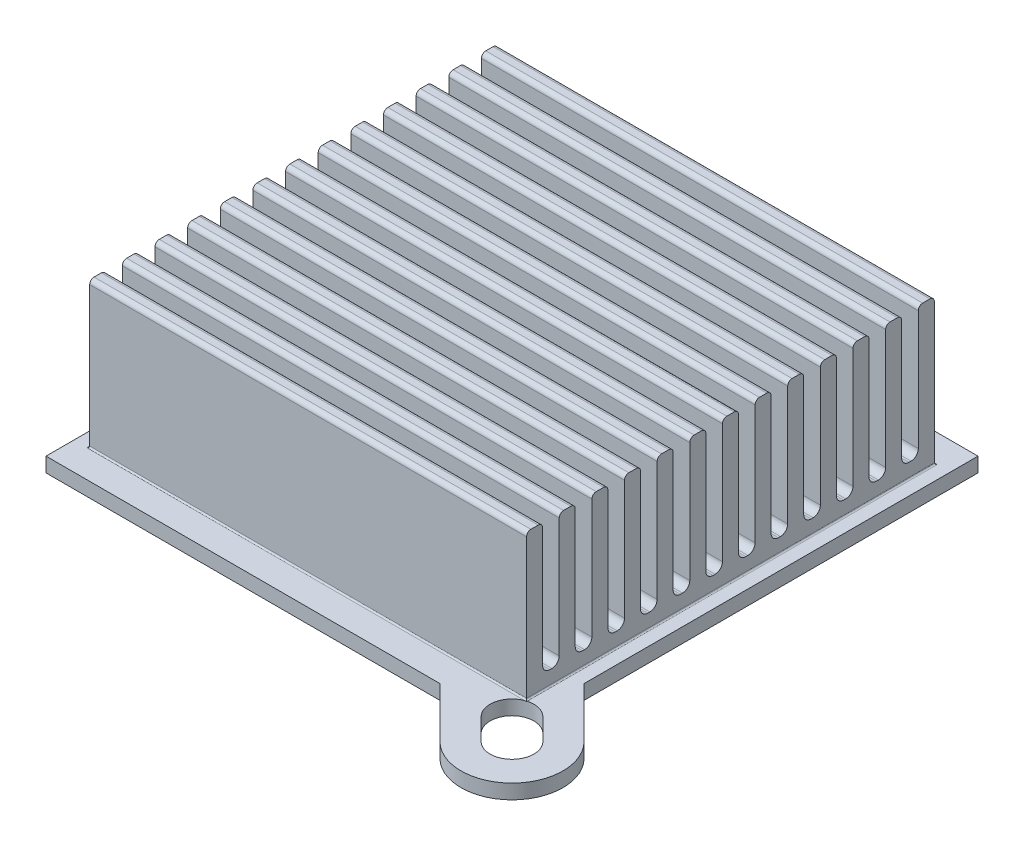
from build123d import *

# Parameters (mm, degrees)
SZKIC1_W                    = 32
SZKIC1_H                    = 32
DODANIE_WYCI_GNI_CIE2_DEPTH = 1
SZKIC3_W                    = 30
SZKIC3_H                    = 28
DODANIE_WYCI_GNI_CIE3_DEPTH = 1
SZKIC2_W                    = 30
SZKIC2_H                    = 1.1
DODANIE_WYCI_GNI_CIE4_DEPTH = 10
ZAOKR_GLENIE1_R             = 0.1
ZAOKR_GLENIE3_R             = 0.5
ZAOKR_GLENIE4_R             = 0.3
WYTNIJ_WYCI_GNI_CIE1_DEPTH  = 31.628220296


with BuildPart() as part:
    # Szkic1 → Dodanie-wyciągnięcie2 (new body)
    with BuildSketch(Plane(origin=(0, 0, 0), x_dir=(1, 0, 0), z_dir=(0, 1, 0))):
        Rectangle(SZKIC1_W, SZKIC1_H)
        with BuildLine():
            Line((-14.495689014, 19.445436483), (19.445436483, -14.495689014))
            ThreePointArc((19.445436483, -14.495689014), (19.445436483, -19.445436483), (14.495689014, -19.445436483))
            Line((14.495689014, -19.445436483), (-19.445436483, 14.495689014))
            ThreePointArc((-19.445436483, 14.495689014), (-19.445436483, 19.445436483), (-14.495689014, 19.445436483))
        make_face()
    extrude(amount=DODANIE_WYCI_GNI_CIE2_DEPTH)

    # Szkic3 → Dodanie-wyciągnięcie3 (add)
    with BuildSketch(Plane(origin=(0, 1, 0), x_dir=(1, 0, 0), z_dir=(0, 1, 0))):
        Rectangle(SZKIC3_W, SZKIC3_H)
    extrude(amount=DODANIE_WYCI_GNI_CIE3_DEPTH)

    # Szkic2 → Dodanie-wyciągnięcie4 (add)
    with BuildSketch(Plane(origin=(0, 1, 0), x_dir=(1, 0, 0), z_dir=(0, 1, 0))):
        with Locations((0, 13.45)):
            Rectangle(SZKIC2_W, SZKIC2_H)
        with Locations((0, 11.208333333)):
            Rectangle(SZKIC2_W, SZKIC2_H)
        with Locations((0, 8.966666667)):
            Rectangle(SZKIC2_W, SZKIC2_H)
        with Locations((0, 6.725)):
            Rectangle(SZKIC2_W, SZKIC2_H)
        with Locations((0, 4.483333333)):
            Rectangle(SZKIC2_W, SZKIC2_H)
        with Locations((0, 2.241666667)):
            Rectangle(SZKIC2_W, SZKIC2_H)
        Rectangle(SZKIC2_W, SZKIC2_H)
        with Locations((0, -2.241666667)):
            Rectangle(SZKIC2_W, SZKIC2_H)
        with Locations((0, -4.483333333)):
            Rectangle(SZKIC2_W, SZKIC2_H)
        with Locations((0, -6.725)):
            Rectangle(SZKIC2_W, SZKIC2_H)
        with Locations((0, -8.966666667)):
            Rectangle(SZKIC2_W, SZKIC2_H)
        with Locations((0, -11.208333333)):
            Rectangle(SZKIC2_W, SZKIC2_H)
        with Locations((0, -13.45)):
            Rectangle(SZKIC2_W, SZKIC2_H)
    extrude(amount=DODANIE_WYCI_GNI_CIE4_DEPTH)

    # Zaokrąglenie1
    zaokr_glenie1_edges = [part.edges().sort_by_distance(p)[0] for p in [
        (15, 1, 0),
        (0, 1, -14),
        (0, 1, 14),
        (-15, 1, 0),
    ]]
    fillet(zaokr_glenie1_edges, radius=ZAOKR_GLENIE1_R)

    # Zaokrąglenie3
    zaokr_glenie3_edges = [part.edges().sort_by_distance(p)[0] for p in [
        (0, 2, 12.9),
        (0, 2, 10.658333333),
        (0, 2, 11.758333333),
        (0, 2, 8.416666667),
        (0, 2, 9.516666667),
        (0, 2, 6.175),
        (0, 2, 7.275),
        (0, 2, 3.933333333),
        (0, 2, 5.033333333),
        (0, 2, 1.691666667),
        (0, 2, 2.791666667),
        (0, 2, -0.55),
        (0, 2, 0.55),
        (0, 2, -2.791666667),
        (0, 2, -1.691666667),
        (0, 2, -5.033333333),
        (0, 2, -3.933333333),
        (0, 2, -7.275),
        (0, 2, -6.175),
        (0, 2, -9.516666667),
        (0, 2, -8.416666667),
        (0, 2, -10.658333333),
        (0, 2, -11.758333333),
        (0, 2, -12.9),
    ]]
    fillet(zaokr_glenie3_edges, radius=ZAOKR_GLENIE3_R)

    # Zaokrąglenie4
    zaokr_glenie4_edges = [part.edges().sort_by_distance(p)[0] for p in [
        (0, 11, 14),
        (0, 11, 12.9),
        (0, 11, 11.758333333),
        (0, 11, 10.658333333),
        (0, 11, 9.516666667),
        (0, 11, 8.416666667),
        (0, 11, 7.275),
        (0, 11, 6.175),
        (0, 11, 5.033333333),
        (0, 11, 3.933333333),
        (0, 11, 2.791666667),
        (0, 11, 1.691666667),
        (0, 11, 0.55),
        (0, 11, -0.55),
        (0, 11, -1.691666667),
        (0, 11, -2.791666667),
        (0, 11, -3.933333333),
        (0, 11, -5.033333333),
        (0, 11, -6.175),
        (0, 11, -7.275),
        (0, 11, -8.416666667),
        (0, 11, -9.516666667),
        (0, 11, -10.658333333),
        (0, 11, -11.758333333),
        (0, 11, -12.9),
        (0, 11, -14),
    ]]
    fillet(zaokr_glenie4_edges, radius=ZAOKR_GLENIE4_R)

    # Szkic4 → Wytnij-wyciągnięcie1 (cut, through all)
    with BuildSketch(Plane(origin=(0, 1, 0), x_dir=(1, 0, 0), z_dir=(0, 1, 0))):
        with BuildLine():
            Line((-15.909902577, 18.03122292), (-14.439120472, 16.560440815))
            ThreePointArc((-14.439120472, 16.560440815), (-14.439120472, 14.439120472), (-16.560440815, 14.439120472))
            Line((-16.560440815, 14.439120472), (-18.03122292, 15.909902577))
            ThreePointArc((-18.03122292, 15.909902577), (-18.03122292, 18.03122292), (-15.909902577, 18.03122292))
        make_face()
        with BuildLine():
            Line((15.909902577, -18.03122292), (14.439120472, -16.560440815))
            ThreePointArc((14.439120472, -16.560440815), (14.439120472, -14.439120472), (16.560440815, -14.439120472))
            Line((16.560440815, -14.439120472), (18.03122292, -15.909902577))
            ThreePointArc((18.03122292, -15.909902577), (18.03122292, -18.03122292), (15.909902577, -18.03122292))
        make_face()
    extrude(amount=-WYTNIJ_WYCI_GNI_CIE1_DEPTH, mode=Mode.SUBTRACT)


solid = part.part
